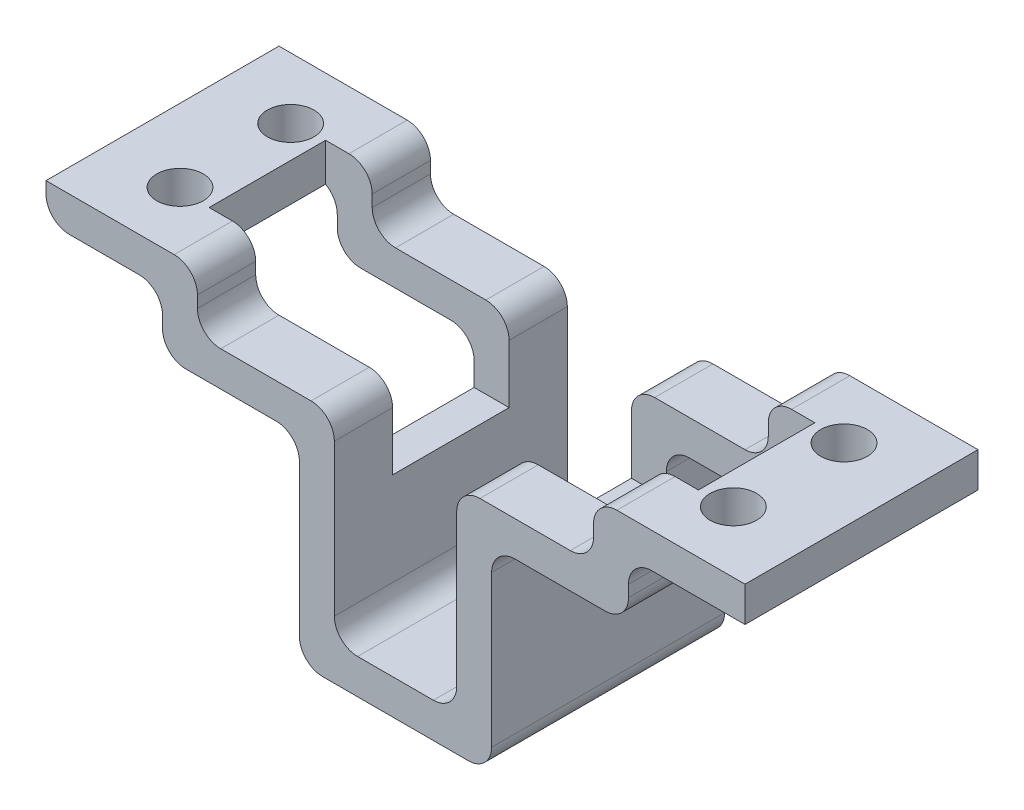
from build123d import *

# Parameters (mm, degrees)
BOSS_EXTRUDE1_DEPTH = 10
SKETCH2_R           = 2
CUT_EXTRUDE1_DEPTH  = 6
SKETCH3_W           = 10
SKETCH3_H           = 12
CUT_EXTRUDE2_DEPTH  = 21
FILLET1_R           = 2


with BuildPart() as part:
    # Sketch1 → Boss-Extrude1 (new, symmetric)
    with BuildSketch(Plane.XY):
        Polygon((-30, 0), (-17, 0), (-17, -5), (-5.25, -5), (-5.25, -22), (5.25, -22), (5.25, -5), (17, -5), (17, 0), (30, 0), (30, -3), (20, -3), (20, -8), (8.25, -8), (8.25, -25), (-8.25, -25), (-8.25, -8), (-20, -8), (-20, -3), (-30, -3), align=None)
    extrude(amount=BOSS_EXTRUDE1_DEPTH, both=True)

    # Sketch2 → Cut-Extrude1 (cut)
    with BuildSketch(Plane(origin=(0, 0, 0), x_dir=(1, 0, 0), z_dir=(0, 1, 0))):
        with Locations(Location((-23.75, 4.75, 0), (0, 0, 270))):
            Circle(SKETCH2_R)
        with Locations(Location((-23.75, -4.75, 0), (0, 0, 270))):
            Circle(SKETCH2_R)
        with Locations(Location((23.75, 4.75, 0), (0, 0, 270))):
            Circle(SKETCH2_R)
        with Locations(Location((23.75, -4.75, 0), (0, 0, 270))):
            Circle(SKETCH2_R)
    extrude(amount=-CUT_EXTRUDE1_DEPTH, mode=Mode.SUBTRACT)

    # Sketch3 → Cut-Extrude2 (cut, symmetric)
    with BuildSketch(Plane(origin=(0, 0, 0), x_dir=(0, 0, -1), z_dir=(1, 0, 0))):
        with Locations((0, -6)):
            Rectangle(SKETCH3_W, SKETCH3_H)
    extrude(amount=CUT_EXTRUDE2_DEPTH, both=True, mode=Mode.SUBTRACT)

    # Fillet1
    # the kernel refuses this fillet: 2 mm, written as the material it adds along each edge
    with BuildSketch(Plane(origin=(-17, -5, 10), x_dir=(0, 1, 0), z_dir=(0, 0, -1)), Plane(origin=(17, -5, 10), x_dir=(-1, 0, 0), z_dir=(0, 0, -1)), Plane(origin=(8.25, -8, 10), x_dir=(1, 0, 0), z_dir=(0, 0, -1)), Plane(origin=(-8.25, -8, 10), x_dir=(0, -1, 0), z_dir=(0, 0, -1)), Plane(origin=(-17, -5, -5), x_dir=(0, 1, 0), z_dir=(0, 0, -1)), Plane(origin=(17, -5, -5), x_dir=(-1, 0, 0), z_dir=(0, 0, -1)), Plane(origin=(-8.25, -8, -5), x_dir=(0, -1, 0), z_dir=(0, 0, -1))) as fillet1_piece_1:
        with BuildLine():
            CenterArc((FILLET1_R, FILLET1_R), FILLET1_R, 180, 90)
            Line((0, FILLET1_R), (0, 0))
            Line((0, 0), (FILLET1_R, 0))
        make_face()
    extrude(amount=5)
    with BuildSketch(Plane(origin=(-5.25, -22, 10), x_dir=(0, 1, 0), z_dir=(0, 0, -1)), Plane(origin=(5.25, -22, 10), x_dir=(-1, 0, 0), z_dir=(0, 0, -1))) as fillet1_piece_2:
        with BuildLine():
            CenterArc((FILLET1_R, FILLET1_R), FILLET1_R, 180, 90)
            Line((0, FILLET1_R), (0, 0))
            Line((0, 0), (FILLET1_R, 0))
        make_face()
    extrude(amount=20)
    with BuildSketch(Plane(origin=(20, -3, 10), x_dir=(1, 0, 0), z_dir=(0, 0, -1))) as fillet1_piece_3_section:
        with BuildLine():
            CenterArc((FILLET1_R, FILLET1_R), FILLET1_R, 180, 90)
            Line((0, FILLET1_R), (0, 0))
            Line((0, 0), (FILLET1_R, 0))
        make_face()
    fillet1_piece_3 = extrude(amount=5, mode=Mode.PRIVATE)
    fillet1_piece_3 = split(fillet1_piece_3, bisect_by=Plane(origin=(21, -3.048479196, 7.515597856), z_dir=(1, 0, 0)), keep=Keep.TOP, mode=Mode.PRIVATE)
    fillet1_piece_3 = fillet1_piece_3 - Plane(origin=(23.75, -3.048479196, 4.75), x_dir=(0, 0, 1), z_dir=(0, 1, 0)) * Cylinder(2, 18, mode=Mode.PRIVATE)
    add(fillet1_piece_3)
    with BuildSketch(Plane(origin=(20, -3, 10), x_dir=(1, 0, 0), z_dir=(0, 0, -1))) as fillet1_piece_4_section:
        with BuildLine():
            CenterArc((FILLET1_R, FILLET1_R), FILLET1_R, 180, 90)
            Line((0, FILLET1_R), (0, 0))
            Line((0, 0), (FILLET1_R, 0))
        make_face()
    fillet1_piece_4 = extrude(amount=5, mode=Mode.PRIVATE)
    fillet1_piece_4 = split(fillet1_piece_4, bisect_by=Plane(origin=(21, -3.51024012, 7.5), z_dir=(-1, 0, 0)), keep=Keep.TOP, mode=Mode.PRIVATE)
    add(fillet1_piece_4)
    with BuildSketch(Plane(origin=(20, -3, 10), x_dir=(1, 0, 0), z_dir=(0, 0, -1))) as fillet1_piece_5_section:
        with BuildLine():
            CenterArc((FILLET1_R, FILLET1_R), FILLET1_R, 180, 90)
            Line((0, FILLET1_R), (0, 0))
            Line((0, 0), (FILLET1_R, 0))
        make_face()
    fillet1_piece_5 = extrude(amount=10, mode=Mode.PRIVATE)
    fillet1_piece_5 = split(fillet1_piece_5, bisect_by=Plane(origin=(21.317615257, -3.049059645, 5), z_dir=(0, 0, -1)), keep=Keep.TOP, mode=Mode.PRIVATE)
    fillet1_piece_5 = split(fillet1_piece_5, bisect_by=Plane(origin=(21, -3.049059645, 2.467907611), z_dir=(1, 0, 0)), keep=Keep.TOP, mode=Mode.PRIVATE)
    fillet1_piece_5 = fillet1_piece_5 - Plane(origin=(23.75, -3.049059645, 4.75), x_dir=(0, 0, 1), z_dir=(0, 1, 0)) * Cylinder(2, 28, mode=Mode.PRIVATE)
    add(fillet1_piece_5)
    with BuildSketch(Plane(origin=(-20, -3, 0), x_dir=(-1, 0, 0), z_dir=(0, 0, 1))) as fillet1_piece_6_section:
        with BuildLine():
            CenterArc((FILLET1_R, FILLET1_R), FILLET1_R, 180, 90)
            Line((0, FILLET1_R), (0, 0))
            Line((0, 0), (FILLET1_R, 0))
        make_face()
    fillet1_piece_6 = extrude(amount=10, mode=Mode.PRIVATE)
    fillet1_piece_6 = split(fillet1_piece_6, bisect_by=Plane(origin=(-21.317615257, -3.049059645, 5), z_dir=(0, 0, -1)), keep=Keep.TOP, mode=Mode.PRIVATE)
    fillet1_piece_6 = split(fillet1_piece_6, bisect_by=Plane(origin=(-21, -3.049059645, 2.46790761), z_dir=(-1, 0, 0)), keep=Keep.TOP, mode=Mode.PRIVATE)
    fillet1_piece_6 = fillet1_piece_6 - Plane(origin=(-23.75, -3.049059645, 4.75), x_dir=(0, 0, 1), z_dir=(0, 1, 0)) * Cylinder(2, 28, mode=Mode.PRIVATE)
    add(fillet1_piece_6)
    with BuildSketch(Plane(origin=(-20, -3, 5), x_dir=(-1, 0, 0), z_dir=(0, 0, 1))) as fillet1_piece_7_section:
        with BuildLine():
            CenterArc((FILLET1_R, FILLET1_R), FILLET1_R, 180, 90)
            Line((0, FILLET1_R), (0, 0))
            Line((0, 0), (FILLET1_R, 0))
        make_face()
    fillet1_piece_7 = extrude(amount=5, mode=Mode.PRIVATE)
    fillet1_piece_7 = split(fillet1_piece_7, bisect_by=Plane(origin=(-21, -3.048479196, 7.515597855), z_dir=(-1, 0, 0)), keep=Keep.TOP, mode=Mode.PRIVATE)
    fillet1_piece_7 = fillet1_piece_7 - Plane(origin=(-23.75, -3.048479196, 4.75), x_dir=(0, 0, 1), z_dir=(0, 1, 0)) * Cylinder(2, 18, mode=Mode.PRIVATE)
    add(fillet1_piece_7)
    with BuildSketch(Plane(origin=(-20, -3, 5), x_dir=(-1, 0, 0), z_dir=(0, 0, 1))) as fillet1_piece_8_section:
        with BuildLine():
            CenterArc((FILLET1_R, FILLET1_R), FILLET1_R, 180, 90)
            Line((0, FILLET1_R), (0, 0))
            Line((0, 0), (FILLET1_R, 0))
        make_face()
    fillet1_piece_8 = extrude(amount=5, mode=Mode.PRIVATE)
    fillet1_piece_8 = split(fillet1_piece_8, bisect_by=Plane(origin=(-21, -3.51024012, 7.5), z_dir=(1, 0, 0)), keep=Keep.TOP, mode=Mode.PRIVATE)
    add(fillet1_piece_8)
    with BuildSketch(Plane(origin=(20, -3, 0), x_dir=(1, 0, 0), z_dir=(0, 0, -1))) as fillet1_piece_9_section:
        with BuildLine():
            CenterArc((FILLET1_R, FILLET1_R), FILLET1_R, 180, 90)
            Line((0, FILLET1_R), (0, 0))
            Line((0, 0), (FILLET1_R, 0))
        make_face()
    fillet1_piece_9 = extrude(amount=10, mode=Mode.PRIVATE)
    fillet1_piece_9 = split(fillet1_piece_9, bisect_by=Plane(origin=(21, -3.049059645, -2.46790761), z_dir=(1, 0, 0)), keep=Keep.TOP, mode=Mode.PRIVATE)
    fillet1_piece_9 = split(fillet1_piece_9, bisect_by=Plane(origin=(21.317615257, -3.049059645, -5), z_dir=(0, 0, 1)), keep=Keep.TOP, mode=Mode.PRIVATE)
    fillet1_piece_9 = fillet1_piece_9 - Plane(origin=(23.75, -3.049059645, -4.75), x_dir=(0, 0, 1), z_dir=(0, 1, 0)) * Cylinder(2, 28, mode=Mode.PRIVATE)
    add(fillet1_piece_9)
    with BuildSketch(Plane(origin=(20, -3, -5), x_dir=(1, 0, 0), z_dir=(0, 0, -1))) as fillet1_piece_10_section:
        with BuildLine():
            CenterArc((FILLET1_R, FILLET1_R), FILLET1_R, 180, 90)
            Line((0, FILLET1_R), (0, 0))
            Line((0, 0), (FILLET1_R, 0))
        make_face()
    fillet1_piece_10 = extrude(amount=5, mode=Mode.PRIVATE)
    fillet1_piece_10 = split(fillet1_piece_10, bisect_by=Plane(origin=(21, -3.048479196, -7.515597854), z_dir=(1, 0, 0)), keep=Keep.TOP, mode=Mode.PRIVATE)
    fillet1_piece_10 = fillet1_piece_10 - Plane(origin=(23.75, -3.048479196, -4.75), x_dir=(0, 0, 1), z_dir=(0, 1, 0)) * Cylinder(2, 18, mode=Mode.PRIVATE)
    add(fillet1_piece_10)
    with BuildSketch(Plane(origin=(20, -3, -5), x_dir=(1, 0, 0), z_dir=(0, 0, -1))) as fillet1_piece_11_section:
        with BuildLine():
            CenterArc((FILLET1_R, FILLET1_R), FILLET1_R, 180, 90)
            Line((0, FILLET1_R), (0, 0))
            Line((0, 0), (FILLET1_R, 0))
        make_face()
    fillet1_piece_11 = extrude(amount=5, mode=Mode.PRIVATE)
    fillet1_piece_11 = split(fillet1_piece_11, bisect_by=Plane(origin=(21, -3.51024012, -7.5), z_dir=(-1, 0, 0)), keep=Keep.TOP, mode=Mode.PRIVATE)
    add(fillet1_piece_11)
    with BuildSketch(Plane(origin=(8.25, -8, -5), x_dir=(0, -1, 0), z_dir=(0, 0, -1))) as fillet1_piece_12:
        with BuildLine():
            CenterArc((FILLET1_R, -FILLET1_R), FILLET1_R, 90, 90)
            Line((0, -FILLET1_R), (0, 0))
            Line((0, 0), (FILLET1_R, 0))
        make_face()
    extrude(amount=5)
    with BuildSketch(Plane(origin=(-20, -3, -10), x_dir=(-1, 0, 0), z_dir=(0, 0, 1))) as fillet1_piece_13_section:
        with BuildLine():
            CenterArc((FILLET1_R, FILLET1_R), FILLET1_R, 180, 90)
            Line((0, FILLET1_R), (0, 0))
            Line((0, 0), (FILLET1_R, 0))
        make_face()
    fillet1_piece_13 = extrude(amount=5, mode=Mode.PRIVATE)
    fillet1_piece_13 = split(fillet1_piece_13, bisect_by=Plane(origin=(-21, -3.048479196, -7.515597855), z_dir=(-1, 0, 0)), keep=Keep.TOP, mode=Mode.PRIVATE)
    fillet1_piece_13 = fillet1_piece_13 - Plane(origin=(-23.75, -3.048479196, -4.75), x_dir=(0, 0, 1), z_dir=(0, 1, 0)) * Cylinder(2, 18, mode=Mode.PRIVATE)
    add(fillet1_piece_13)
    with BuildSketch(Plane(origin=(-20, -3, -10), x_dir=(-1, 0, 0), z_dir=(0, 0, 1))) as fillet1_piece_14_section:
        with BuildLine():
            CenterArc((FILLET1_R, FILLET1_R), FILLET1_R, 180, 90)
            Line((0, FILLET1_R), (0, 0))
            Line((0, 0), (FILLET1_R, 0))
        make_face()
    fillet1_piece_14 = extrude(amount=5, mode=Mode.PRIVATE)
    fillet1_piece_14 = split(fillet1_piece_14, bisect_by=Plane(origin=(-21, -3.51024012, -7.5), z_dir=(1, 0, 0)), keep=Keep.TOP, mode=Mode.PRIVATE)
    add(fillet1_piece_14)
    with BuildSketch(Plane(origin=(-20, -3, -10), x_dir=(-1, 0, 0), z_dir=(0, 0, 1))) as fillet1_piece_15_section:
        with BuildLine():
            CenterArc((FILLET1_R, FILLET1_R), FILLET1_R, 180, 90)
            Line((0, FILLET1_R), (0, 0))
            Line((0, 0), (FILLET1_R, 0))
        make_face()
    fillet1_piece_15 = extrude(amount=10, mode=Mode.PRIVATE)
    fillet1_piece_15 = split(fillet1_piece_15, bisect_by=Plane(origin=(-21, -3.049059645, -2.467907611), z_dir=(-1, 0, 0)), keep=Keep.TOP, mode=Mode.PRIVATE)
    fillet1_piece_15 = split(fillet1_piece_15, bisect_by=Plane(origin=(-21.317615257, -3.049059645, -5), z_dir=(0, 0, 1)), keep=Keep.TOP, mode=Mode.PRIVATE)
    fillet1_piece_15 = fillet1_piece_15 - Plane(origin=(-23.75, -3.049059645, -4.75), x_dir=(0, 0, 1), z_dir=(0, 1, 0)) * Cylinder(2, 28, mode=Mode.PRIVATE)
    add(fillet1_piece_15)
    # the kernel refuses this fillet: 2 mm, written as the material it takes off along each edge
    with BuildSketch(Plane(origin=(-17, 0, 15), x_dir=(-1, 0, 0), z_dir=(0, 0, -1)), Plane(origin=(20, -8, 15), x_dir=(0, 1, 0), z_dir=(0, 0, -1)), Plane(origin=(-20, -8, 15), x_dir=(1, 0, 0), z_dir=(0, 0, -1)), Plane(origin=(-17, 0, 0), x_dir=(-1, 0, 0), z_dir=(0, 0, -1)), Plane(origin=(5.25, -5, 0), x_dir=(0, -1, 0), z_dir=(0, 0, -1))) as fillet1_2_piece_1:
        with BuildLine():
            CenterArc((FILLET1_R, -FILLET1_R), FILLET1_R, 90, 90)
            Line((0, -FILLET1_R), (0, 0))
            Line((0, 0), (FILLET1_R, 0))
        make_face()
    extrude(amount=15, mode=Mode.SUBTRACT)
    with BuildSketch(Plane(origin=(-5.25, -5, 15), x_dir=(0, -1, 0), z_dir=(0, 0, -1)), Plane(origin=(5.25, -5, 15), x_dir=(1, 0, 0), z_dir=(0, 0, -1)), Plane(origin=(17, 0, 15), x_dir=(1, 0, 0), z_dir=(0, 0, -1)), Plane(origin=(-5.25, -5, 0), x_dir=(0, -1, 0), z_dir=(0, 0, -1)), Plane(origin=(17, 0, 0), x_dir=(1, 0, 0), z_dir=(0, 0, -1)), Plane(origin=(20, -8, 0), x_dir=(-1, 0, 0), z_dir=(0, 0, -1)), Plane(origin=(-20, -8, 0), x_dir=(0, 1, 0), z_dir=(0, 0, -1))) as fillet1_2_piece_2:
        with BuildLine():
            CenterArc((FILLET1_R, FILLET1_R), FILLET1_R, 180, 90)
            Line((0, FILLET1_R), (0, 0))
            Line((0, 0), (FILLET1_R, 0))
        make_face()
    extrude(amount=15, mode=Mode.SUBTRACT)
    with BuildSketch(Plane(origin=(8.25, -25, 15), x_dir=(-1, 0, 0), z_dir=(0, 0, -1)), Plane(origin=(-8.25, -25, 15), x_dir=(0, 1, 0), z_dir=(0, 0, -1)), Plane(origin=(-30, -3, -15), x_dir=(1, 0, 0), z_dir=(0, 0, 1))) as fillet1_2_piece_3:
        with BuildLine():
            CenterArc((FILLET1_R, FILLET1_R), FILLET1_R, 180, 90)
            Line((0, FILLET1_R), (0, 0))
            Line((0, 0), (FILLET1_R, 0))
        make_face()
    extrude(amount=30, mode=Mode.SUBTRACT)


solid = part.part
